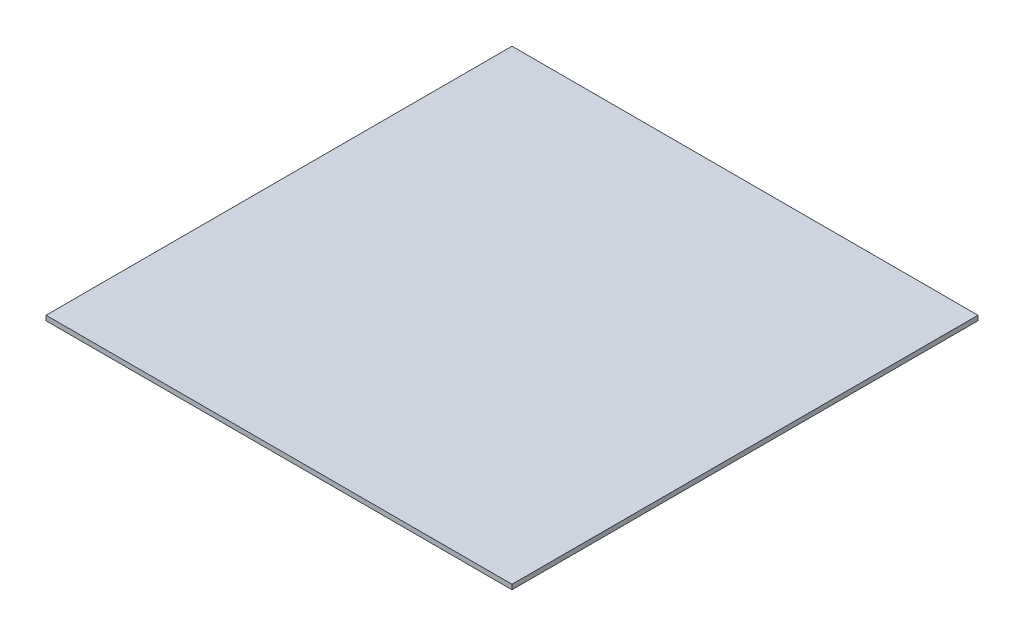
from build123d import *

# Parameters (mm, degrees)
SKETCH1_W           = 389.157257684
SKETCH1_H           = 389.157257685
BOSS_EXTRUDE1_DEPTH = 4


with BuildPart() as part:
    # Sketch1 → Boss-Extrude1 (new body)
    with BuildSketch(Plane(origin=(0, 0, 0), x_dir=(1, 0, 0), z_dir=(0, 1, 0))):
        with Locations((143.939939874, 134.817528994)):
            Rectangle(SKETCH1_W, SKETCH1_H)
    extrude(amount=BOSS_EXTRUDE1_DEPTH)


solid = part.part
